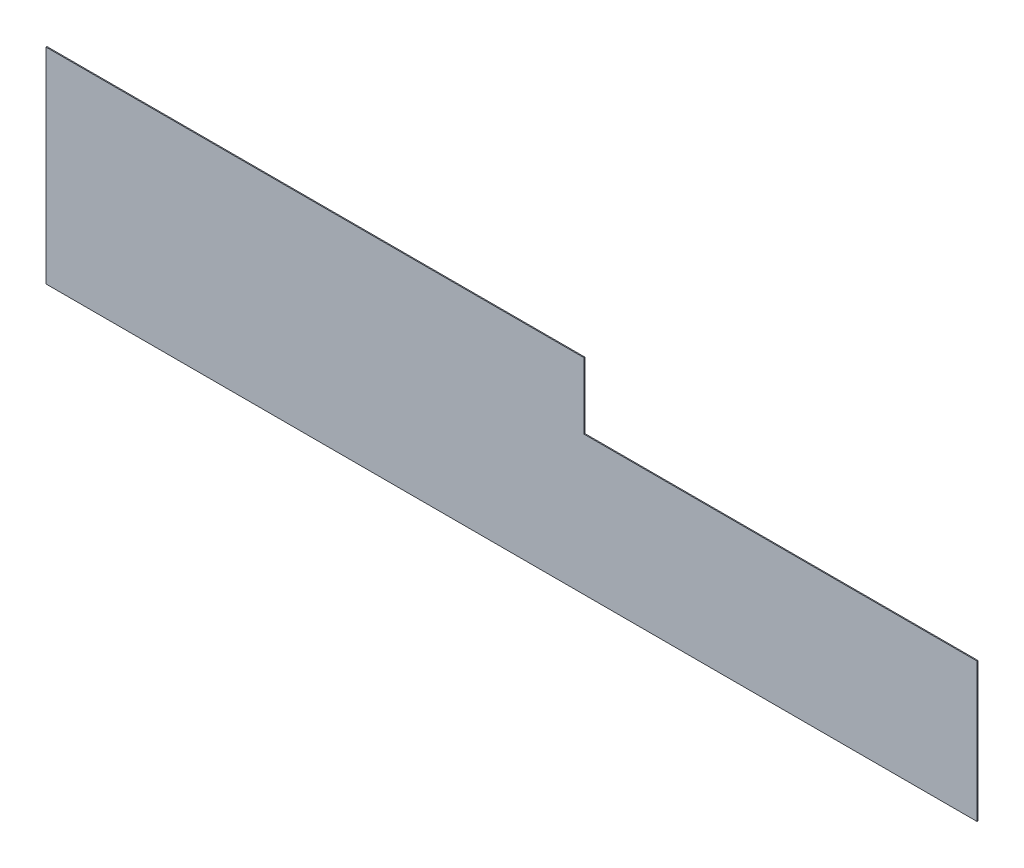
from build123d import *

# Parameters (mm, degrees)
TABAN_FLAN_1_DEPTH = 6


# Sheet-metal steps are written as plain solids
with BuildPart() as part:
    # Çizim1 → Taban-Flanş1 (new body)
    with BuildSketch(Plane.XY):
        Polygon((0, 0), (0, 1255), (3290, 1255), (3290, 850), (5695, 850), (5695, 0), align=None)
    extrude(amount=-TABAN_FLAN_1_DEPTH)


solid = part.part
